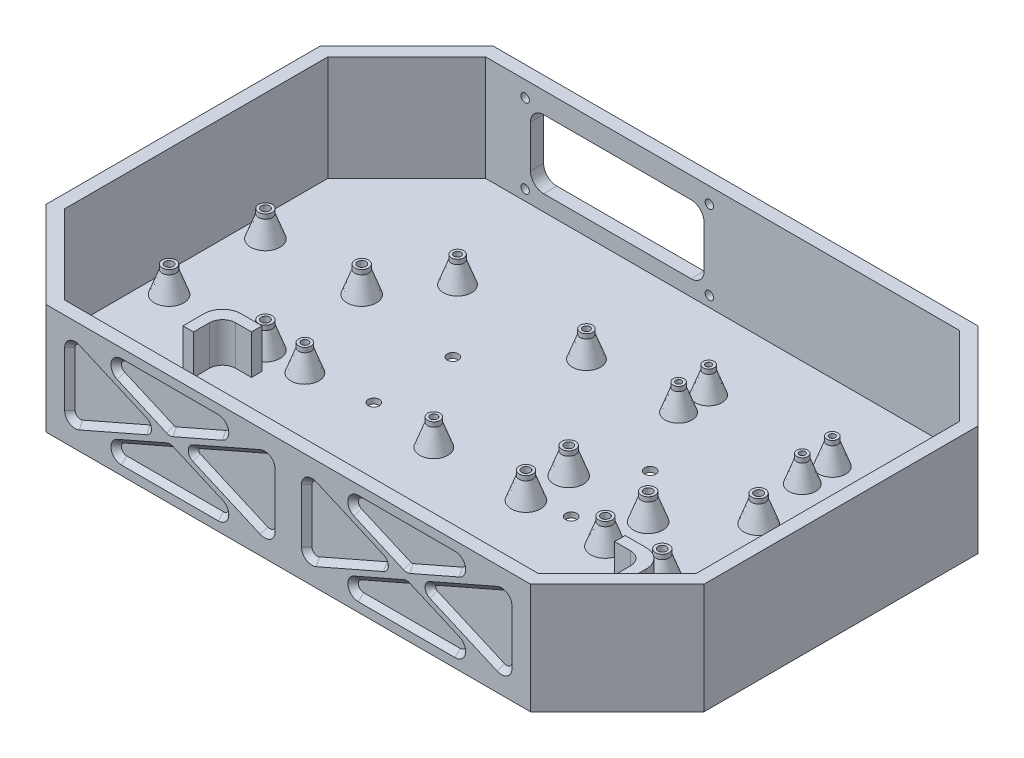
from build123d import *

# Parameters (mm, degrees)
BOSS_EXTRUDE1_DEPTH     = 2
BOSS_EXTRUDE2_DEPTH     = 40
SKETCH2_R               = 2.6
SKETCH2_R_2             = 2.35
SKETCH2_R_3             = 2.1
BOSS_EXTRUDE3_DEPTH     = 10
CUT_EXTRUDE1_DEPTH      = 157.364957711
CUT_EXTRUDE1_DEPTH_BACK = 157.364957711
SKETCH2_3_R             = 1.6
SKETCH2_3_R_2           = 1.1
SKETCH2_3_R_3           = 1.35
BOSS_EXTRUDE4_DEPTH     = 15
FILLET1_R               = 5
FILLET2_R               = 7
CUT_EXTRUDE2_START      = -85
SKETCH4_R               = 1.6
CUT_EXTRUDE2_DEPTH      = 5
CUT_EXTRUDE3_START      = -85
CUT_EXTRUDE3_DEPTH      = 2
CUT_EXTRUDE4_START      = 83
CUT_EXTRUDE4_DEPTH      = 2
CHAMFER1_SIZE           = 2
CUT_EXTRUDE5_DEPTH      = 157.364957711
CUT_EXTRUDE5_DEPTH_BACK = 157.364957711
SKETCH6_R               = 2.1
CHAMFER2_SIZE           = 3
CHAMFER2_SIZE2          = 8.242432258


with BuildPart() as part:
    # Sketch1 → Boss-Extrude1 (new body)
    with BuildSketch(Plane(origin=(0, 0, 0), x_dir=(1, 0, 0), z_dir=(0, 1, 0))):
        Polygon((125, 52.071067812), (125, -52.071067812), (92.071067812, -85), (-92.071067812, -85), (-125, -52.071067812), (-125, 52.071067812), (-92.071067812, 85), (92.071067812, 85), align=None)
    extrude(amount=-BOSS_EXTRUDE1_DEPTH)

    # Sketch1<3> → Boss-Extrude2 (add)
    with BuildSketch(Plane(origin=(0, 0, 0), x_dir=(1, 0, 0), z_dir=(0, 1, 0))):
        Polygon((92.071067812, 85), (125, 52.071067812), (125, -52.071067812), (92.071067812, -85), (-92.071067812, -85), (-125, -52.071067812), (-125, 52.071067812), (-92.071067812, 85), align=None)
        Polygon((-90, 80), (-120, 50), (-120, -50), (-90, -80), (90, -80), (120, -50), (120, 50), (90, 80), align=None, mode=Mode.SUBTRACT)
    extrude(amount=BOSS_EXTRUDE2_DEPTH)

    # Sketch2 → Boss-Extrude3 (add)
    with BuildSketch(Plane(origin=(0, 0, 0), x_dir=(1, 0, 0), z_dir=(0, 1, 0))):
        with Locations(Location((-112, 18.3, 0), (0, 0, 270))):
            Circle(SKETCH2_R)
        with Locations(Location((-112, -18.3, 0), (0, 0, 270))):
            Circle(SKETCH2_R)
        with Locations(Location((-75.4, -18.3, 0), (0, 0, 270))):
            Circle(SKETCH2_R)
        with Locations(Location((-75.4, 18.3, 0), (0, 0, 270))):
            Circle(SKETCH2_R)
        with Locations(Location((-60.4, 39.7, 0), (0, 0, 270))):
            Circle(SKETCH2_R_2)
        with Locations(Location((-11.4, 39.7, 0), (0, 0, 270))):
            Circle(SKETCH2_R_2)
        with Locations(Location((-11.4, -18.3, 0), (0, 0, 270))):
            Circle(SKETCH2_R_2)
        with Locations(Location((-60.4, -18.3, 0), (0, 0, 270))):
            Circle(SKETCH2_R_2)
        with Locations(Location((23.6, -18.3, 0), (0, 0, 270))):
            Circle(SKETCH2_R)
        with Locations(Location((23.6, -2.05, 0), (0, 0, 270))):
            Circle(SKETCH2_R)
        with Locations(Location((53.8, -2.05, 0), (0, 0, 270))):
            Circle(SKETCH2_R)
        with Locations(Location((53.8, -18.3, 0), (0, 0, 270))):
            Circle(SKETCH2_R)
        with Locations(Location((23.6, 51.1, 0), (0, 0, 270))):
            Circle(SKETCH2_R_3)
        with Locations(Location((23.6, 39.7, 0), (0, 0, 270))):
            Circle(SKETCH2_R_3)
        with Locations(Location((70.6, 39.7, 0), (0, 0, 270))):
            Circle(SKETCH2_R_3)
        with Locations(Location((70.6, 51.1, 0), (0, 0, 270))):
            Circle(SKETCH2_R_3)
        with Locations(Location((75.4, 18.3, 0), (0, 0, 270))):
            Circle(SKETCH2_R)
        with Locations(Location((112, 18.3, 0), (0, 0, 270))):
            Circle(SKETCH2_R)
        with Locations(Location((112, -18.3, 0), (0, 0, 270))):
            Circle(SKETCH2_R)
        with Locations(Location((75.4, -18.3, 0), (0, 0, 270))):
            Circle(SKETCH2_R)
    extrude(amount=BOSS_EXTRUDE3_DEPTH)

    # Sketch2<3> → Cut-Extrude1 (cut, two sides: drawn at the far end of the back side and taken through both)
    with BuildSketch(Plane(origin=(0, 0, 0), x_dir=(1, 0, 0), z_dir=(0, 1, 0)).offset(-CUT_EXTRUDE1_DEPTH_BACK)):
        with Locations(Location((112, -18.3, 0), (0, 0, 270))):
            Circle(SKETCH2_3_R)
        with Locations(Location((75.4, -18.3, 0), (0, 0, 270))):
            Circle(SKETCH2_3_R)
        with Locations(Location((75.4, 18.3, 0), (0, 0, 270))):
            Circle(SKETCH2_3_R)
        with Locations(Location((112, 18.3, 0), (0, 0, 270))):
            Circle(SKETCH2_3_R)
        with Locations(Location((-75.4, 18.3, 0), (0, 0, 270))):
            Circle(SKETCH2_3_R)
        with Locations(Location((-75.4, -18.3, 0), (0, 0, 270))):
            Circle(SKETCH2_3_R)
        with Locations(Location((-112, -18.3, 0), (0, 0, 270))):
            Circle(SKETCH2_3_R)
        with Locations(Location((-112, 18.3, 0), (0, 0, 270))):
            Circle(SKETCH2_3_R)
        with Locations(Location((53.8, -18.3, 0), (0, 0, 270))):
            Circle(SKETCH2_3_R)
        with Locations(Location((23.6, -18.3, 0), (0, 0, 270))):
            Circle(SKETCH2_3_R)
        with Locations(Location((23.6, -2.05, 0), (0, 0, 270))):
            Circle(SKETCH2_3_R)
        with Locations(Location((53.8, -2.05, 0), (0, 0, 270))):
            Circle(SKETCH2_3_R)
        with Locations(Location((70.6, 39.7, 0), (0, 0, 270))):
            Circle(SKETCH2_3_R_2)
        with Locations(Location((23.6, 39.7, 0), (0, 0, 270))):
            Circle(SKETCH2_3_R_2)
        with Locations(Location((23.6, 51.1, 0), (0, 0, 270))):
            Circle(SKETCH2_3_R_2)
        with Locations(Location((70.6, 51.1, 0), (0, 0, 270))):
            Circle(SKETCH2_3_R_2)
        with Locations(Location((-11.4, 39.7, 0), (0, 0, 270))):
            Circle(SKETCH2_3_R_3)
        with Locations(Location((-60.4, 39.7, 0), (0, 0, 270))):
            Circle(SKETCH2_3_R_3)
        with Locations(Location((-60.4, -18.3, 0), (0, 0, 270))):
            Circle(SKETCH2_3_R_3)
        with Locations(Location((-11.4, -18.3, 0), (0, 0, 270))):
            Circle(SKETCH2_3_R_3)
    extrude(amount=CUT_EXTRUDE1_DEPTH + CUT_EXTRUDE1_DEPTH_BACK, mode=Mode.SUBTRACT)

    # Sketch3 → Boss-Extrude4 (add)
    with BuildSketch(Plane(origin=(0, 0, 0), x_dir=(1, 0, 0), z_dir=(0, 1, 0))):
        Polygon((-80, -41), (-80, -30), (-69, -30), (-69, -26), (-84, -26), (-84, -41), align=None)
        Polygon((69, -26), (69, -30), (80, -30), (80, -41), (84, -41), (84, -26), align=None)
    extrude(amount=BOSS_EXTRUDE4_DEPTH)

    # Fillet1
    fillet1_edges = [part.edges().sort_by_distance(p)[0] for p in [
        (-80, 7.5, 30),
        (80, 7.5, 30),
    ]]
    fillet(fillet1_edges, radius=FILLET1_R)

    # Fillet2
    fillet2_edges = [part.edges().sort_by_distance(p)[0] for p in [
        (-84, 7.5, 26),
        (84, 7.5, 26),
    ]]
    fillet(fillet2_edges, radius=FILLET2_R)

    # Sketch4 → Cut-Extrude2 (cut)
    with BuildSketch(Plane.XY.offset(CUT_EXTRUDE2_START)):
        with BuildLine():
            ThreePointArc((-73, 27), (-71.535533906, 30.535533906), (-68, 32))
            Line((-68, 32), (-12, 32))
            ThreePointArc((-12, 32), (-8.464466094, 30.535533906), (-7, 27))
            Line((-7, 27), (-7, 11))
            ThreePointArc((-7, 11), (-8.464466094, 7.464466094), (-12, 6))
            Line((-12, 6), (-68, 6))
            ThreePointArc((-68, 6), (-71.535533906, 7.464466094), (-73, 11))
            Line((-73, 11), (-73, 27))
        make_face()
        with Locations(Location((-75, 34, 0), (0, 0, 180))):
            Circle(SKETCH4_R)
        with Locations(Location((-75, 4, 0), (0, 0, 180))):
            Circle(SKETCH4_R)
        with Locations(Location((-5, 4, 0), (0, 0, 180))):
            Circle(SKETCH4_R)
        with Locations(Location((-5, 34, 0), (0, 0, 180))):
            Circle(SKETCH4_R)
    extrude(amount=CUT_EXTRUDE2_DEPTH, mode=Mode.SUBTRACT)

    # Sketch4<3> → Cut-Extrude3 (cut)
    with BuildSketch(Plane.XY.offset(CUT_EXTRUDE3_START)):
        with BuildLine():
            Line((35.421247865, 19.916157335), (9.801637668, 31.124736796))
            ThreePointArc((9.801637668, 31.124736796), (7.90530263, 30.966231455), (7, 29.292422126))
            Line((7, 29.292422126), (7, 8.707577874))
            ThreePointArc((7, 8.707577874), (7.90530263, 7.033768545), (9.801637668, 6.875263204))
            Line((9.801637668, 6.875263204), (35.421247865, 18.083842665))
            ThreePointArc((35.421247865, 18.083842665), (36.020429031, 19), (35.421247865, 19.916157335))
        make_face()
        with BuildLine():
            ThreePointArc((63.382679145, 34.5), (65.340309006, 32.909493993), (64.184316813, 30.66768533))
            Line((64.184316813, 30.66768533), (45.400818834, 22.449904964))
            ThreePointArc((45.400818834, 22.449904964), (45, 22.366062299), (44.599181166, 22.449904964))
            Line((44.599181166, 22.449904964), (25.815683187, 30.66768533))
            ThreePointArc((25.815683187, 30.66768533), (24.659690994, 32.909493993), (26.617320855, 34.5))
            Line((26.617320855, 34.5), (63.382679145, 34.5))
        make_face()
        with BuildLine():
            Line((64.184316813, 7.33231467), (45.400818834, 15.550095036))
            ThreePointArc((45.400818834, 15.550095036), (45, 15.633937701), (44.599181166, 15.550095036))
            Line((44.599181166, 15.550095036), (25.815683187, 7.33231467))
            ThreePointArc((25.815683187, 7.33231467), (24.659690994, 5.090506007), (26.617320855, 3.5))
            Line((26.617320855, 3.5), (63.382679145, 3.5))
            ThreePointArc((63.382679145, 3.5), (65.340309006, 5.090506007), (64.184316813, 7.33231467))
        make_face()
        with BuildLine():
            ThreePointArc((54.578752135, 18.083842665), (53.979570969, 19), (54.578752135, 19.916157335))
            Line((54.578752135, 19.916157335), (80.198362332, 31.124736796))
            ThreePointArc((80.198362332, 31.124736796), (82.09469737, 30.966231455), (83, 29.292422126))
            Line((83, 29.292422126), (83, 8.707577874))
            ThreePointArc((83, 8.707577874), (82.09469737, 7.033768545), (80.198362332, 6.875263204))
            Line((80.198362332, 6.875263204), (54.578752135, 18.083842665))
        make_face()
    extrude(amount=CUT_EXTRUDE3_DEPTH, mode=Mode.SUBTRACT)

    # Sketch5 → Cut-Extrude4 (cut)
    with BuildSketch(Plane.XY.offset(CUT_EXTRUDE4_START)):
        with BuildLine():
            Line((44.599181166, 15.550095036), (25.815683187, 7.33231467))
            ThreePointArc((25.815683187, 7.33231467), (24.659690994, 5.090506007), (26.617320855, 3.5))
            Line((26.617320855, 3.5), (63.382679145, 3.5))
            ThreePointArc((63.382679145, 3.5), (65.340309006, 5.090506007), (64.184316813, 7.33231467))
            Line((64.184316813, 7.33231467), (45.400818834, 15.550095036))
            ThreePointArc((45.400818834, 15.550095036), (45, 15.633937701), (44.599181166, 15.550095036))
        make_face()
        with BuildLine():
            Line((83, 29.292422126), (83, 8.707577874))
            ThreePointArc((83, 8.707577874), (82.09469737, 7.033768545), (80.198362332, 6.875263204))
            Line((80.198362332, 6.875263204), (54.578752135, 18.083842665))
            ThreePointArc((54.578752135, 18.083842665), (53.979570969, 19), (54.578752135, 19.916157335))
            Line((54.578752135, 19.916157335), (80.198362332, 31.124736796))
            ThreePointArc((80.198362332, 31.124736796), (82.09469737, 30.966231455), (83, 29.292422126))
        make_face()
        with BuildLine():
            Line((64.184316813, 30.66768533), (45.400818834, 22.449904964))
            ThreePointArc((45.400818834, 22.449904964), (45, 22.366062299), (44.599181166, 22.449904964))
            Line((44.599181166, 22.449904964), (25.815683187, 30.66768533))
            ThreePointArc((25.815683187, 30.66768533), (24.659690994, 32.909493993), (26.617320855, 34.5))
            Line((26.617320855, 34.5), (63.382679145, 34.5))
            ThreePointArc((63.382679145, 34.5), (65.340309006, 32.909493993), (64.184316813, 30.66768533))
        make_face()
        with BuildLine():
            Line((9.801637668, 6.875263204), (35.421247865, 18.083842665))
            ThreePointArc((35.421247865, 18.083842665), (36.020429031, 19), (35.421247865, 19.916157335))
            Line((35.421247865, 19.916157335), (9.801637668, 31.124736796))
            ThreePointArc((9.801637668, 31.124736796), (7.90530263, 30.966231455), (7, 29.292422126))
            Line((7, 29.292422126), (7, 8.707577874))
            ThreePointArc((7, 8.707577874), (7.90530263, 7.033768545), (9.801637668, 6.875263204))
        make_face()
        with BuildLine():
            Line((-35.421247865, 19.916157335), (-9.801637668, 31.124736796))
            ThreePointArc((-9.801637668, 31.124736796), (-7.90530263, 30.966231455), (-7, 29.292422126))
            Line((-7, 29.292422126), (-7, 8.707577874))
            ThreePointArc((-7, 8.707577874), (-7.90530263, 7.033768545), (-9.801637668, 6.875263204))
            Line((-9.801637668, 6.875263204), (-35.421247865, 18.083842665))
            ThreePointArc((-35.421247865, 18.083842665), (-36.020429031, 19), (-35.421247865, 19.916157335))
        make_face()
        with BuildLine():
            Line((-44.599181166, 22.449904964), (-25.815683187, 30.66768533))
            ThreePointArc((-25.815683187, 30.66768533), (-24.659690994, 32.909493993), (-26.617320855, 34.5))
            Line((-26.617320855, 34.5), (-63.382679145, 34.5))
            ThreePointArc((-63.382679145, 34.5), (-65.340309006, 32.909493993), (-64.184316813, 30.66768533))
            Line((-64.184316813, 30.66768533), (-45.400818834, 22.449904964))
            ThreePointArc((-45.400818834, 22.449904964), (-45, 22.366062299), (-44.599181166, 22.449904964))
        make_face()
        with BuildLine():
            Line((-80.198362332, 6.875263204), (-54.578752135, 18.083842665))
            ThreePointArc((-54.578752135, 18.083842665), (-53.979570969, 19), (-54.578752135, 19.916157335))
            Line((-54.578752135, 19.916157335), (-80.198362332, 31.124736796))
            ThreePointArc((-80.198362332, 31.124736796), (-82.09469737, 30.966231455), (-83, 29.292422126))
            Line((-83, 29.292422126), (-83, 8.707577874))
            ThreePointArc((-83, 8.707577874), (-82.09469737, 7.033768545), (-80.198362332, 6.875263204))
        make_face()
        with BuildLine():
            Line((-26.617320855, 3.5), (-63.382679145, 3.5))
            ThreePointArc((-63.382679145, 3.5), (-65.340309006, 5.090506007), (-64.184316813, 7.33231467))
            Line((-64.184316813, 7.33231467), (-45.400818834, 15.550095036))
            ThreePointArc((-45.400818834, 15.550095036), (-45, 15.633937701), (-44.599181166, 15.550095036))
            Line((-44.599181166, 15.550095036), (-25.815683187, 7.33231467))
            ThreePointArc((-25.815683187, 7.33231467), (-24.659690994, 5.090506007), (-26.617320855, 3.5))
        make_face()
    extrude(amount=CUT_EXTRUDE4_DEPTH, mode=Mode.SUBTRACT)

    # Chamfer1
    chamfer1_edges = [part.edges().sort_by_distance(p)[0] for p in [
        (45, 15.633937701, -85),
        (35.207432176, 11.441204853, -85),
        (54.792567824, 11.441204853, -85),
        (24.659690994, 5.090506007, -85),
        (65.340309006, 5.090506007, -85),
        (45, 3.5, -85),
        (45, 22.366062299, -85),
        (35.207432176, 26.558795147, -85),
        (54.792567824, 26.558795147, -85),
        (24.659690994, 32.909493993, -85),
        (65.340309006, 32.909493993, -85),
        (45, 34.5, -85),
        (53.979570969, 19, -85),
        (67.388557234, 25.520447065, -85),
        (67.388557234, 12.479552935, -85),
        (82.09469737, 30.966231455, -85),
        (82.09469737, 7.033768545, -85),
        (83, 19, -85),
        (36.020429031, 19, -85),
        (22.611442766, 25.520447065, -85),
        (22.611442766, 12.479552935, -85),
        (7.90530263, 30.966231455, -85),
        (7.90530263, 7.033768545, -85),
        (7, 19, -85),
        (53.979570969, 19, 85),
        (67.388557234, 25.520447065, 85),
        (67.388557234, 12.479552935, 85),
        (82.09469737, 30.966231455, 85),
        (82.09469737, 7.033768545, 85),
        (83, 19, 85),
        (45, 22.366062299, 85),
        (35.207432176, 26.558795147, 85),
        (54.792567824, 26.558795147, 85),
        (24.659690994, 32.909493993, 85),
        (65.340309006, 32.909493993, 85),
        (45, 34.5, 85),
        (45, 15.633937701, 85),
        (54.792567824, 11.441204853, 85),
        (35.207432176, 11.441204853, 85),
        (65.340309006, 5.090506007, 85),
        (24.659690994, 5.090506007, 85),
        (45, 3.5, 85),
        (36.020429031, 19, 85),
        (22.611442766, 12.479552935, 85),
        (22.611442766, 25.520447065, 85),
        (7.90530263, 7.033768545, 85),
        (7.90530263, 30.966231455, 85),
        (7, 19, 85),
        (-36.020429031, 19, 85),
        (-22.611442766, 25.520447065, 85),
        (-22.611442766, 12.479552935, 85),
        (-7.90530263, 30.966231455, 85),
        (-7.90530263, 7.033768545, 85),
        (-7, 19, 85),
        (-45, 15.633937701, 85),
        (-35.207432176, 11.441204853, 85),
        (-54.792567824, 11.441204853, 85),
        (-24.659690994, 5.090506007, 85),
        (-65.340309006, 5.090506007, 85),
        (-45, 3.5, 85),
        (-45, 22.366062299, 85),
        (-54.792567824, 26.558795147, 85),
        (-35.207432176, 26.558795147, 85),
        (-65.340309006, 32.909493993, 85),
        (-24.659690994, 32.909493993, 85),
        (-45, 34.5, 85),
        (-53.979570969, 19, 85),
        (-67.388557234, 12.479552935, 85),
        (-67.388557234, 25.520447065, 85),
        (-82.09469737, 7.033768545, 85),
        (-82.09469737, 30.966231455, 85),
        (-83, 19, 85),
    ]]
    chamfer(chamfer1_edges, length=CHAMFER1_SIZE - 0.0001)  # a hair under: the kernel refuses the full size

    # Sketch6 → Cut-Extrude5 (cut, two sides: drawn at the far end of the back side and taken through both)
    with BuildSketch(Plane(origin=(0, 0, 0), x_dir=(1, 0, 0), z_dir=(0, 1, 0)).offset(-CUT_EXTRUDE5_DEPTH_BACK)):
        with Locations(Location((37.5, 15, 0), (0, 0, 270))):
            Circle(SKETCH6_R)
        with Locations(Location((37.5, -15, 0), (0, 0, 270))):
            Circle(SKETCH6_R)
        with Locations(Location((-37.5, -15, 0), (0, 0, 270))):
            Circle(SKETCH6_R)
        with Locations(Location((-37.5, 15, 0), (0, 0, 270))):
            Circle(SKETCH6_R)
    extrude(amount=CUT_EXTRUDE5_DEPTH + CUT_EXTRUDE5_DEPTH_BACK, mode=Mode.SUBTRACT)

    # Chamfer2
    chamfer2_edges = [part.edges().sort_by_distance(p)[0] for p in [
        (-60.4, 0, 15.95),
        (-11.4, 0, 15.95),
        (-11.4, 0, -42.05),
        (23.6, 0, -41.8),
        (23.6, 0, -53.2),
        (70.6, 0, -41.8),
        (70.6, 0, -53.2),
        (53.8, 0, -0.55),
        (23.6, 0, -0.55),
        (23.6, 0, 15.7),
        (53.8, 0, 15.7),
        (75.4, 0, 15.7),
        (75.4, 0, -20.9),
        (112, 0, -20.9),
        (112, 0, 15.7),
        (-112, 0, -20.9),
        (-112, 0, 15.7),
        (-75.4, 0, 15.7),
        (-75.4, 0, -20.9),
        (-60.4, 0, -42.05),
    ]]
    chamfer2_side = [part.faces().sort_by_distance(p)[0] for p in [
        (-0.094705852, 0, -0.10687594),
    ]]
    chamfer(chamfer2_edges, length=CHAMFER2_SIZE, length2=CHAMFER2_SIZE2, reference=chamfer2_side[0])


solid = part.part
